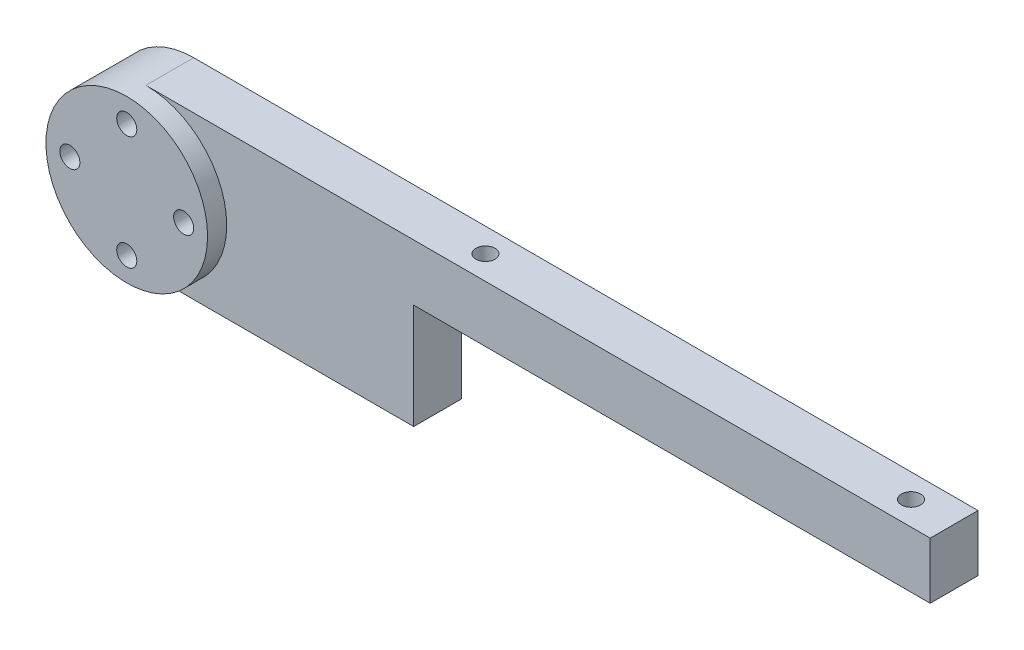
from build123d import *
from build123d.topology import SkipClean

# Parameters (mm, degrees)
SKETCH_1_R          = 1.05
EXTRUDE_1_DEPTH     = 2.5
SKETCH_2_W          = 82
SKETCH_2_H          = 7
CUT_EXTRUDE_1_DEPTH = 2.5
SKETCH_3_W          = 79
SKETCH_3_H          = 4
EXTRUDE_2_DEPTH     = 10.7
SKETCH_4_W          = 0.401921616
SKETCH_4_H          = 13.2
EXTRUDE_3_DEPTH     = 0.6
SKETCH_5_W          = 6.198078384
SKETCH_5_H          = 0.4
EXTRUDE_4_DEPTH     = 0.4
SKETCH_6_W          = 79
SKETCH_6_H          = 6.717043916
CUT_EXTRUDE_2_DEPTH = 20
EXTRUDE_START       = 2.5
SKETCH_7_R          = 1.05
EXTRUDE_5_DEPTH     = 2.5
SKETCH_9_R          = 1
CUT_EXTRUDE_3_DEPTH = 10
SKETCH_10_R         = 1
CUT_EXTRUDE_4_DEPTH = 10
SKETCH_11_W         = 5
SKETCH_11_H         = 9.9
CUT_EXTRUDE_5_DEPTH = 28
SKETCH_13_R         = 8.45
SKETCH_13_R_2       = 1.05
EXTRUDE_7_DEPTH     = 2


with BuildPart() as part:
    # 스케치1 → 보스-돌출1 (new body)
    with BuildSketch(Plane.XY):
        with BuildLine():
            Line((0, 8.45), (110, 8.45))
            Line((110, 8.45), (110, -8.45))
            Line((110, -8.45), (0, -8.45))
            ThreePointArc((0, -8.45), (-8.45, 0), (0, 8.45))
        make_face()
        with Locations((-5.95, 0)):
            Circle(SKETCH_1_R, mode=Mode.SUBTRACT)
        with Locations((0, 5.95)):
            Circle(SKETCH_1_R, mode=Mode.SUBTRACT)
        with Locations((5.95, 0)):
            Circle(SKETCH_1_R, mode=Mode.SUBTRACT)
        with Locations((0, -5.95)):
            Circle(SKETCH_1_R, mode=Mode.SUBTRACT)
    extrude(amount=EXTRUDE_1_DEPTH)

    # 스케치2 → 컷-돌출1 (cut)
    with BuildSketch(Plane(origin=(0, 0, 0), x_dir=(-1, 0, 0), z_dir=(0, 0, -1))):
        with Locations((-69, -4.95)):
            Rectangle(SKETCH_2_W, SKETCH_2_H)
    extrude(amount=-CUT_EXTRUDE_1_DEPTH, mode=Mode.SUBTRACT)

    # 스케치3 → 보스-돌출2 (add)
    with BuildSketch(Plane(origin=(0, 0, 0), x_dir=(-1, 0, 0), z_dir=(0, 0, -1))):
        with Locations((-67.5, 0.55)):
            Rectangle(SKETCH_3_W, SKETCH_3_H)
    extrude(amount=EXTRUDE_2_DEPTH)

    # 스케치4 → 보스-돌출3 (add)
    with BuildSketch(Plane.XZ.offset(1.45)):
        with Locations((74.1, -4.1)):
            Rectangle(SKETCH_4_W, SKETCH_4_H)
        with Locations((67.5, -4.1)):
            Rectangle(SKETCH_4_W, SKETCH_4_H)
        with Locations((80.7, -4.1)):
            Rectangle(SKETCH_4_W, SKETCH_4_H)
        with Locations((87.3, -4.1)):
            Rectangle(SKETCH_4_W, SKETCH_4_H)
        with Locations((93.9, -4.1)):
            Rectangle(SKETCH_4_W, SKETCH_4_H)
    extrude(amount=EXTRUDE_3_DEPTH)

    # 스케치5 → 보스-돌출4 (add)
    with BuildSketch(Plane.XZ.offset(1.45)):
        with Locations((70.8, 0.95)):
            Rectangle(SKETCH_5_W, SKETCH_5_H)
        with Locations((70.8, -9.15)):
            Rectangle(SKETCH_5_W, SKETCH_5_H)
        with Locations((77.4, 0.95)):
            Rectangle(SKETCH_5_W, SKETCH_5_H)
        with Locations((77.4, -9.15)):
            Rectangle(SKETCH_5_W, SKETCH_5_H)
        with Locations((84, 0.95)):
            Rectangle(SKETCH_5_W, SKETCH_5_H)
        with Locations((84, -9.15)):
            Rectangle(SKETCH_5_W, SKETCH_5_H)
        with Locations((90.6, 0.95)):
            Rectangle(SKETCH_5_W, SKETCH_5_H)
        with Locations((90.6, -9.15)):
            Rectangle(SKETCH_5_W, SKETCH_5_H)
    extrude(amount=EXTRUDE_4_DEPTH)

    # 스케치6 → 컷-돌출2 (cut)
    with BuildSketch(Plane(origin=(0, 0, -10.7), x_dir=(-1, 0, 0), z_dir=(0, 0, -1))):
        with Locations((-67.5, -0.808521958)):
            Rectangle(SKETCH_6_W, SKETCH_6_H)
    extrude(amount=-CUT_EXTRUDE_2_DEPTH, mode=Mode.SUBTRACT)

    # 스케치7 → 보스-돌출5 (add)
    with SkipClean():  # the faces are left unmerged after this step: merging them gives an invalid solid
        with BuildSketch(Plane(origin=(0, 0, 0), x_dir=(-1, 0, 0), z_dir=(0, 0, -1)).offset(EXTRUDE_START)):
            with BuildLine():
                Line((-110, -1.45), (-107, -1.45))
                Line((-107, -1.45), (-107, 2.55))
                Line((-107, 2.55), (-28, 2.55))
                Line((-28, 2.55), (-28, -8.45))
                Line((-28, -8.45), (0, -8.45))
                ThreePointArc((0, -8.45), (8.402739403, -0.892451973), (1.774921032, 8.261486266))
                ThreePointArc((1.774921032, 8.261486266), (0.892451973, 8.402739403), (0, 8.45))
                Line((0, 8.45), (-110, 8.45))
                Line((-110, 8.45), (-110, -1.45))
            make_face()
            with Locations((0, -5.95)):
                Circle(SKETCH_7_R, mode=Mode.SUBTRACT)
            with Locations((-5.95, 0)):
                Circle(SKETCH_7_R, mode=Mode.SUBTRACT)
            with Locations((5.95, 0)):
                Circle(SKETCH_7_R, mode=Mode.SUBTRACT)
            with Locations((0, 5.95)):
                Circle(SKETCH_7_R, mode=Mode.SUBTRACT)
        extrude(amount=-EXTRUDE_5_DEPTH)

    # 스케치9 → 컷-돌출3 (cut)
    with SkipClean():  # the faces are left unmerged after this step: merging them gives an invalid solid
        with BuildSketch(Plane.XZ.offset(-2.55)):
            with Locations((102, 0)):
                Circle(SKETCH_9_R)
            with Locations((33, 0)):
                Circle(SKETCH_9_R)
        extrude(amount=-CUT_EXTRUDE_3_DEPTH, mode=Mode.SUBTRACT)

    # 스케치10 → 컷-돌출4 (cut)
    with SkipClean():  # the faces are left unmerged after this step: merging them gives an invalid solid
        with BuildSketch(Plane.XZ.offset(-2.55)):
            with Locations((77.5, 0)):
                Circle(SKETCH_10_R)
        extrude(amount=-CUT_EXTRUDE_4_DEPTH, mode=Mode.SUBTRACT)

    # 스케치11 → 컷-돌출5 (cut)
    with SkipClean():  # the faces are left unmerged after this step: merging them gives an invalid solid
        with BuildSketch(Plane(origin=(110, 0, 0), x_dir=(0, 0, -1), z_dir=(1, 0, 0))):
            with Locations((0, 3.5)):
                Rectangle(SKETCH_11_W, SKETCH_11_H)
        extrude(amount=-CUT_EXTRUDE_5_DEPTH, mode=Mode.SUBTRACT)

    # 스케치13 → 보스-돌출7 (add)
    with BuildSketch(Plane.XY.offset(2.5)):
        Circle(SKETCH_13_R)
        with Locations((0, -5.95)):
            Circle(SKETCH_13_R_2, mode=Mode.SUBTRACT)
        with Locations((5.95, 0)):
            Circle(SKETCH_13_R_2, mode=Mode.SUBTRACT)
        with Locations((0, 5.95)):
            Circle(SKETCH_13_R_2, mode=Mode.SUBTRACT)
        with Locations((-5.95, 0)):
            Circle(SKETCH_13_R_2, mode=Mode.SUBTRACT)
    extrude(amount=EXTRUDE_7_DEPTH)


solid = part.part
